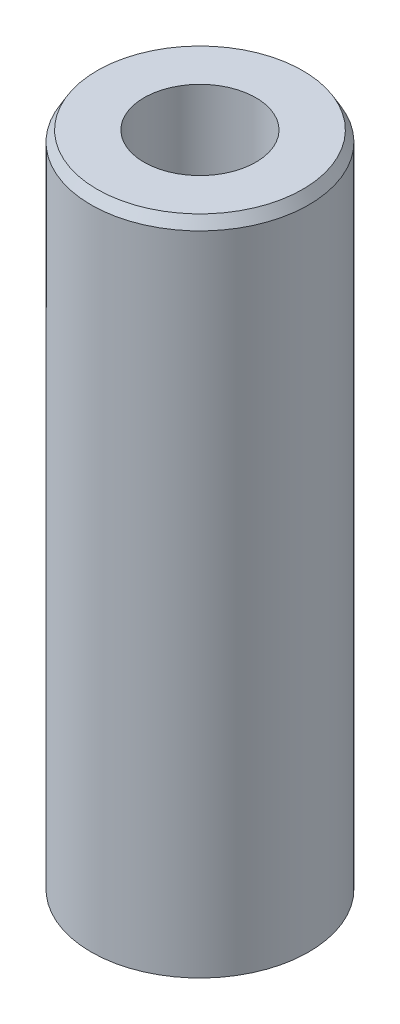
from build123d import *
from OCP.BRepFilletAPI import BRepFilletAPI_MakeChamfer

# Parameters (mm, degrees)
SKETCH1_R           = 47.5
BOSS_EXTRUDE1_DEPTH = 289.484519406
SKETCH2_R           = 24.399987989
CUT_EXTRUDE1_DEPTH  = 298.17635669
CHAMFER1_SIZE       = 4.563145584
CHAMFER1_SIZE2      = 2.634533331


with BuildPart() as part:
    # Sketch1 → Boss-Extrude1 (new body)
    with BuildSketch(Plane(origin=(0, 0, 0), x_dir=(1, 0, 0), z_dir=(0, 1, 0))):
        Circle(SKETCH1_R)
    extrude(amount=BOSS_EXTRUDE1_DEPTH)

    # Sketch2 → Cut-Extrude1 (cut, through all)
    with BuildSketch(Plane(origin=(0, 0, 0), x_dir=(1, 0, 0), z_dir=(0, 1, 0))):
        Circle(SKETCH2_R)
    extrude(amount=CUT_EXTRUDE1_DEPTH, mode=Mode.SUBTRACT)

    # Chamfer1: one chamfer whose edges measure the first distance from different faces: ONE call of the kernel's chamfer builder (chamfer() names one face for all edges)
    chamfer1_edges_1 = [part.edges().sort_by_distance(p)[0] for p in [
        (-47.5, 289.484519406, 0),
    ]]
    chamfer1_side_1 = [part.faces().sort_by_distance(p)[0] for p in [
        (-47.5, 144.742259703, 0),
    ]]
    chamfer1_edges_2 = [part.edges().sort_by_distance(p)[0] for p in [
        (-47.5, 0, 0),
    ]]
    chamfer1_side_2 = [part.faces().sort_by_distance(p)[0] for p in [
        (-46.156497116, 0, 0),
    ]]
    chamfer1 = BRepFilletAPI_MakeChamfer(part.part.solid().wrapped)
    for e in chamfer1_edges_1:
        chamfer1.Add(CHAMFER1_SIZE, CHAMFER1_SIZE2, e.wrapped, chamfer1_side_1[0].wrapped)  # the first distance lies on this face
    for e in chamfer1_edges_2:
        chamfer1.Add(CHAMFER1_SIZE, CHAMFER1_SIZE2, e.wrapped, chamfer1_side_2[0].wrapped)  # the first distance lies on this face
    add(Compound.cast(chamfer1.Shape()), mode=Mode.REPLACE)


solid = part.part
